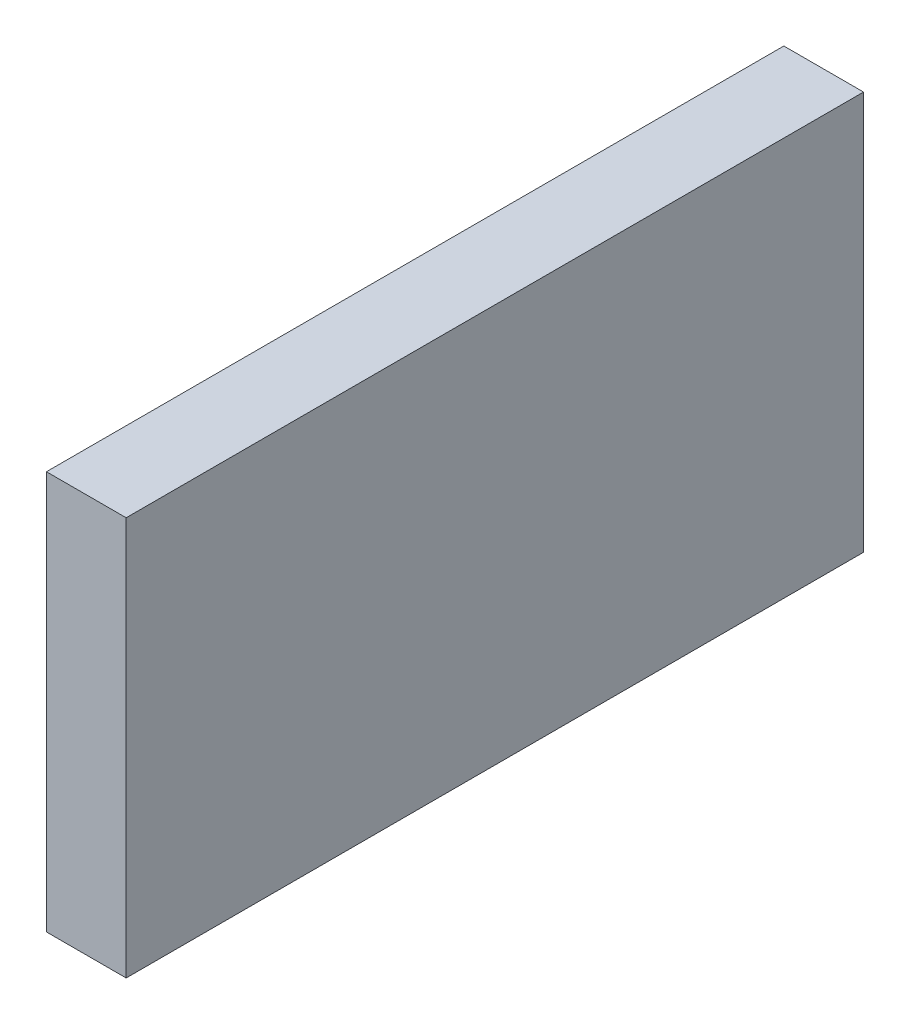
from build123d import *

# Parameters (mm, degrees)
SKETCH2_W           = 37
SKETCH2_H           = 20
BOSS_EXTRUDE1_DEPTH = 4


with BuildPart() as part:
    # Sketch2 → Boss-Extrude1 (new body)
    with BuildSketch(Plane(origin=(0, 0, 0), x_dir=(0, 0, -1), z_dir=(1, 0, 0))):
        with Locations((18.5, 10)):
            Rectangle(SKETCH2_W, SKETCH2_H)
    extrude(amount=BOSS_EXTRUDE1_DEPTH)


solid = part.part
